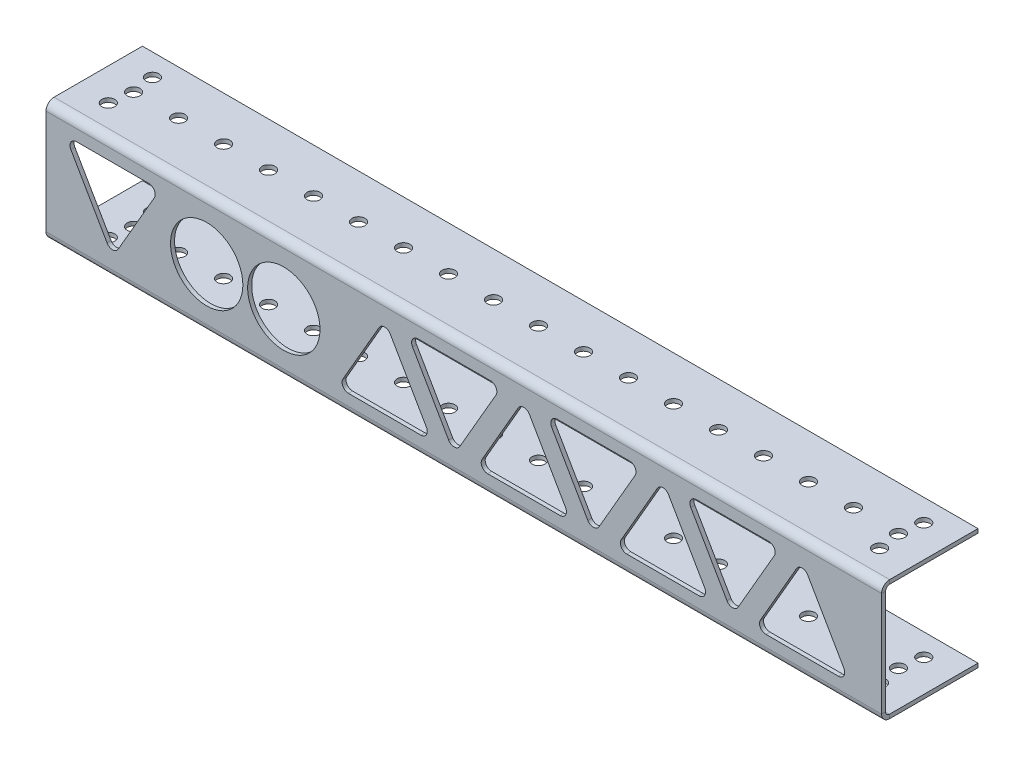
from build123d import *

# Parameters (mm, degrees)
BASE_FLANGE1_DEPTH = 165.1
SKETCH6_R          = 2.54
CUT_EXTRUDE1_DEPTH = 173.973769801
SKETCH8_R          = 14.2875
CUT_EXTRUDE2_DEPTH = 172.104223081
SKETCH9_R          = 14.2875
CUT_EXTRUDE3_DEPTH = 2.54
CUT_EXTRUDE4_DEPTH = 2.54
SKETCH11_R         = 2.54
CUT_EXTRUDE5_DEPTH = 173.973769801


# Sheet-metal steps are written as plain solids
with BuildPart() as part:
    # Sketch1 → Base-Flange1 (new, symmetric)
    with BuildSketch(Plane(origin=(0, 0, 0), x_dir=(0, 0, -1), z_dir=(1, 0, 0))):
        with BuildLine():
            Line((18.25625, 22.225), (-16.66875, 22.225))
            ThreePointArc((-16.66875, 22.225), (-17.791282015, 21.760032015), (-18.25625, 20.6375))
            Line((-18.25625, 20.6375), (-18.25625, -20.6375))
            ThreePointArc((-18.25625, -20.6375), (-17.791282015, -21.760032015), (-16.66875, -22.225))
            Line((-16.66875, -22.225), (18.25625, -22.225))
            Line((18.25625, -22.225), (18.25625, -23.8125))
            Line((18.25625, -23.8125), (-16.66875, -23.8125))
            ThreePointArc((-16.66875, -23.8125), (-18.91381403, -22.88256403), (-19.84375, -20.6375))
            Line((-19.84375, -20.6375), (-19.84375, 20.6375))
            ThreePointArc((-19.84375, 20.6375), (-18.91381403, 22.88256403), (-16.66875, 23.8125))
            Line((-16.66875, 23.8125), (18.25625, 23.8125))
            Line((18.25625, 23.8125), (18.25625, 22.225))
        make_face()
    extrude(amount=BASE_FLANGE1_DEPTH, both=True)

    # Sketch6 → Cut-Extrude1 (cut, through all)
    with BuildSketch(Plane(origin=(0, 23.8125, 0), x_dir=(1, 0, 0), z_dir=(0, 1, 0))):
        with Locations(Location((151.13, 0.79375, 0), (0, 0, 270))):
            Circle(SKETCH6_R)
        with Locations(Location((133.35, 0.79375, 0), (0, 0, 270))):
            Circle(SKETCH6_R)
        with Locations(Location((115.57, 0.79375, 0), (0, 0, 270))):
            Circle(SKETCH6_R)
        with Locations(Location((97.79, 0.79375, 0), (0, 0, 270))):
            Circle(SKETCH6_R)
        with Locations(Location((80.01, 0.79375, 0), (0, 0, 270))):
            Circle(SKETCH6_R)
        with Locations(Location((62.23, 0.79375, 0), (0, 0, 270))):
            Circle(SKETCH6_R)
        with Locations(Location((44.45, 0.79375, 0), (0, 0, 270))):
            Circle(SKETCH6_R)
        with Locations(Location((26.67, 0.79375, 0), (0, 0, 270))):
            Circle(SKETCH6_R)
        with Locations(Location((8.89, 0.79375, 0), (0, 0, 270))):
            Circle(SKETCH6_R)
        with Locations(Location((-8.89, 0.79375, 0), (0, 0, 270))):
            Circle(SKETCH6_R)
        with Locations(Location((-26.67, 0.79375, 0), (0, 0, 270))):
            Circle(SKETCH6_R)
        with Locations(Location((-44.45, 0.79375, 0), (0, 0, 270))):
            Circle(SKETCH6_R)
        with Locations(Location((-62.23, 0.79375, 0), (0, 0, 270))):
            Circle(SKETCH6_R)
        with Locations(Location((-80.01, 0.79375, 0), (0, 0, 270))):
            Circle(SKETCH6_R)
        with Locations(Location((-97.79, 0.79375, 0), (0, 0, 270))):
            Circle(SKETCH6_R)
        with Locations(Location((-115.57, 0.79375, 0), (0, 0, 270))):
            Circle(SKETCH6_R)
        with Locations(Location((-133.35, 0.79375, 0), (0, 0, 270))):
            Circle(SKETCH6_R)
        with Locations(Location((-151.13, 0.79375, 0), (0, 0, 270))):
            Circle(SKETCH6_R)
    extrude(amount=-CUT_EXTRUDE1_DEPTH, mode=Mode.SUBTRACT)

    # Sketch8 → Cut-Extrude2 (cut, through all)
    with BuildSketch(Plane.XY.offset(19.84375)):
        with Locations((-101.6, 0)):
            Circle(SKETCH8_R)
    extrude(amount=-CUT_EXTRUDE2_DEPTH, mode=Mode.SUBTRACT)

    # Sketch9 → Cut-Extrude3 (cut)
    with BuildSketch(Plane.XY.offset(19.84375)):
        with Locations((-71.12, 0)):
            Circle(SKETCH9_R)
        with BuildLine():
            Line((135.902216058, 12.3825), (150.200295474, -12.3825))
            ThreePointArc((150.200295474, -12.3825), (150.200295474, -14.9225), (148.000590949, -16.1925))
            Line((148.000590949, -16.1925), (119.404432116, -16.1925))
            ThreePointArc((119.404432116, -16.1925), (117.20472759, -14.9225), (117.20472759, -12.3825))
            Line((117.20472759, -12.3825), (131.502807007, 12.3825))
            ThreePointArc((131.502807007, 12.3825), (133.702511532, 13.6525), (135.902216058, 12.3825))
        make_face()
        with BuildLine():
            Line((91.908125546, 16.1925), (120.504284379, 16.1925))
            ThreePointArc((120.504284379, 16.1925), (122.703988904, 14.9225), (122.703988904, 12.3825))
            Line((122.703988904, 12.3825), (108.405909488, -12.3825))
            ThreePointArc((108.405909488, -12.3825), (106.206204962, -13.6525), (104.006500437, -12.3825))
            Line((104.006500437, -12.3825), (89.70842102, 12.3825))
            ThreePointArc((89.70842102, 12.3825), (89.70842102, 14.9225), (91.908125546, 16.1925))
        make_face()
        with BuildLine():
            Line((62.21211445, -12.3825), (76.510193866, 12.3825))
            ThreePointArc((76.510193866, 12.3825), (78.709898392, 13.6525), (80.909602918, 12.3825))
            Line((80.909602918, 12.3825), (95.207682334, -12.3825))
            ThreePointArc((95.207682334, -12.3825), (95.207682334, -14.9225), (93.007977808, -16.1925))
            Line((93.007977808, -16.1925), (64.411818976, -16.1925))
            ThreePointArc((64.411818976, -16.1925), (62.21211445, -14.9225), (62.21211445, -12.3825))
        make_face()
        with BuildLine():
            Line((34.71580788, 12.3825), (49.013887296, -12.3825))
            ThreePointArc((49.013887296, -12.3825), (51.213591822, -13.6525), (53.413296347, -12.3825))
            Line((53.413296347, -12.3825), (67.711375764, 12.3825))
            ThreePointArc((67.711375764, 12.3825), (67.711375764, 14.9225), (65.511671238, 16.1925))
            Line((65.511671238, 16.1925), (36.915512405, 16.1925))
            ThreePointArc((36.915512405, 16.1925), (34.71580788, 14.9225), (34.71580788, 12.3825))
        make_face()
        with BuildLine():
            Line((21.517580726, 12.3825), (7.21950131, -12.3825))
            ThreePointArc((7.21950131, -12.3825), (7.21950131, -14.9225), (9.419205835, -16.1925))
            Line((9.419205835, -16.1925), (38.015364668, -16.1925))
            ThreePointArc((38.015364668, -16.1925), (40.215069194, -14.9225), (40.215069194, -12.3825))
            Line((40.215069194, -12.3825), (25.916989777, 12.3825))
            ThreePointArc((25.916989777, 12.3825), (23.717285252, 13.6525), (21.517580726, 12.3825))
        make_face()
        with BuildLine():
            Line((-18.077100735, 16.1925), (10.519058098, 16.1925))
            ThreePointArc((10.519058098, 16.1925), (12.718762624, 14.9225), (12.718762624, 12.3825))
            Line((12.718762624, 12.3825), (-1.579316793, -12.3825))
            ThreePointArc((-1.579316793, -12.3825), (-3.779021318, -13.6525), (-5.978725844, -12.3825))
            Line((-5.978725844, -12.3825), (-20.276805261, 12.3825))
            ThreePointArc((-20.276805261, 12.3825), (-20.276805261, 14.9225), (-18.077100735, 16.1925))
        make_face()
        with BuildLine():
            Line((-33.475032414, 12.3825), (-47.773111831, -12.3825))
            ThreePointArc((-47.773111831, -12.3825), (-47.773111831, -14.9225), (-45.573407305, -16.1925))
            Line((-45.573407305, -16.1925), (-16.977248472, -16.1925))
            ThreePointArc((-16.977248472, -16.1925), (-14.777543947, -14.9225), (-14.777543947, -12.3825))
            Line((-14.777543947, -12.3825), (-29.075623363, 12.3825))
            ThreePointArc((-29.075623363, 12.3825), (-31.275327889, 13.6525), (-33.475032414, 12.3825))
        make_face()
    extrude(amount=-CUT_EXTRUDE3_DEPTH, mode=Mode.SUBTRACT)

    # Sketch10 → Cut-Extrude4 (cut)
    with BuildSketch(Plane.XY.offset(19.84375)):
        with BuildLine():
            Line((-155.280295474, 12.3825), (-140.982216058, -12.3825))
            ThreePointArc((-140.982216058, -12.3825), (-138.782511532, -13.6525), (-136.582807007, -12.3825))
            Line((-136.582807007, -12.3825), (-122.28472759, 12.3825))
            ThreePointArc((-122.28472759, 12.3825), (-122.28472759, 14.9225), (-124.484432116, 16.1925))
            Line((-124.484432116, 16.1925), (-153.080590949, 16.1925))
            ThreePointArc((-153.080590949, 16.1925), (-155.280295474, 14.9225), (-155.280295474, 12.3825))
        make_face()
    extrude(amount=-CUT_EXTRUDE4_DEPTH, mode=Mode.SUBTRACT)

    # Sketch11 → Cut-Extrude5 (cut, through all)
    with BuildSketch(Plane(origin=(0, 23.8125, 0), x_dir=(1, 0, 0), z_dir=(0, 1, 0))):
        with Locations(Location((152.4, 9.525, 0), (0, 0, 270))):
            Circle(SKETCH11_R)
        with Locations(Location((152.4, -7.9375, 0), (0, 0, 270))):
            Circle(SKETCH11_R)
        with Locations(Location((-152.4, -7.9375, 0), (0, 0, 270))):
            Circle(SKETCH11_R)
        with Locations(Location((-152.4, 9.525, 0), (0, 0, 270))):
            Circle(SKETCH11_R)
    extrude(amount=-CUT_EXTRUDE5_DEPTH, mode=Mode.SUBTRACT)


solid = part.part
